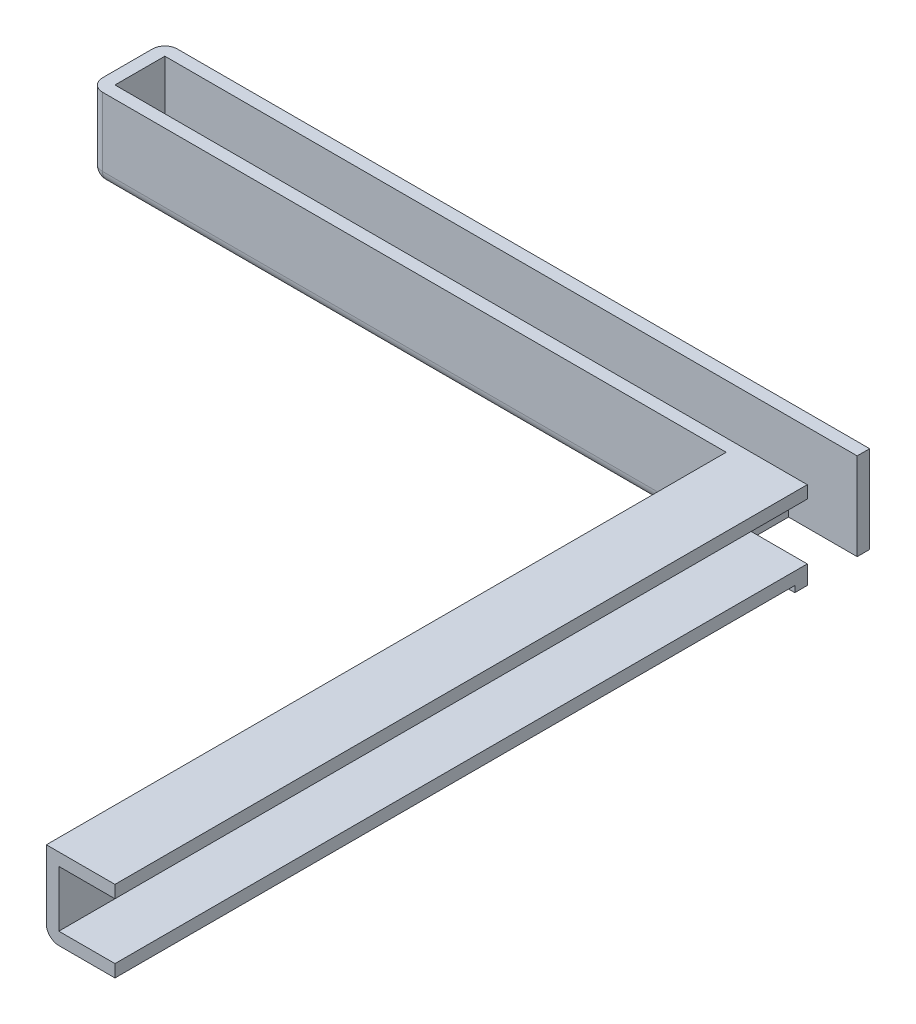
from build123d import *

# Parameters (mm, degrees)
BOSS_EXTRUDE1_DEPTH = 2
BOSS_EXTRUDE2_DEPTH = 11
SKETCH3_W           = 9
SKETCH3_H           = 9
CUT_EXTRUDE1_DEPTH  = 2
BOSS_EXTRUDE3_DEPTH = 109
BOSS_EXTRUDE4_DEPTH = 1
FILLET1_R           = 2


with BuildPart() as part:
    # Sketch1 → Boss-Extrude1 (new body)
    with BuildSketch(Plane(origin=(0, 0, 0), x_dir=(1, 0, 0), z_dir=(0, 1, 0))):
        Polygon((0, 0), (0, -12), (113, -12), (113, -10), (102, -10), (102, -2), (113, -2), (113, 0), align=None)
    extrude(amount=BOSS_EXTRUDE1_DEPTH)

    # Sketch2 → Boss-Extrude2 (add)
    with BuildSketch(Plane(origin=(0, 2, 0), x_dir=(1, 0, 0), z_dir=(0, 1, 0))):
        Polygon((2, -10), (2, -2), (102, -2), (113, -2), (113, 0), (0, 0), (0, -12), (113, -12), (113, -10), (102, -10), align=None)
    extrude(amount=BOSS_EXTRUDE2_DEPTH)

    # Sketch3 → Cut-Extrude1 (cut)
    with BuildSketch(Plane.XY.offset(12)):
        with Locations((108.5, 6.5)):
            Rectangle(SKETCH3_W, SKETCH3_H)
    extrude(amount=-CUT_EXTRUDE1_DEPTH, mode=Mode.SUBTRACT)

    # Sketch3<3> → Boss-Extrude3 (add)
    with BuildSketch(Plane.XY.offset(12)):
        Polygon((113, 0), (113, 2), (104, 2), (104, 11), (113, 11), (113, 13), (102, 13), (102, 0), align=None)
    extrude(amount=BOSS_EXTRUDE3_DEPTH)

    # Sketch1<3> → Boss-Extrude4 (add)
    with BuildSketch(Plane(origin=(0, 0, 0), x_dir=(1, 0, 0), z_dir=(0, 1, 0))):
        Polygon((113, 0), (100, 0), (100, -12), (113, -12), (113, -10), (102, -10), (102, -2), (113, -2), align=None)
    extrude(amount=-BOSS_EXTRUDE4_DEPTH)

    # Fillet1
    fillet1_edges = [part.edges().sort_by_distance(p)[0] for p in [
        (100, -0.5, 0),
        (50, 0, 12),
        (0, 0, 6),
        (50, 0, 0),
        (0, 6.5, 12),
        (0, 6.5, 0),
        (102, 0, 66.5),
        (100, -0.5, 12),
    ]]
    fillet(fillet1_edges, radius=FILLET1_R - 0.0001)  # a hair under: the kernel refuses the full size


solid = part.part
